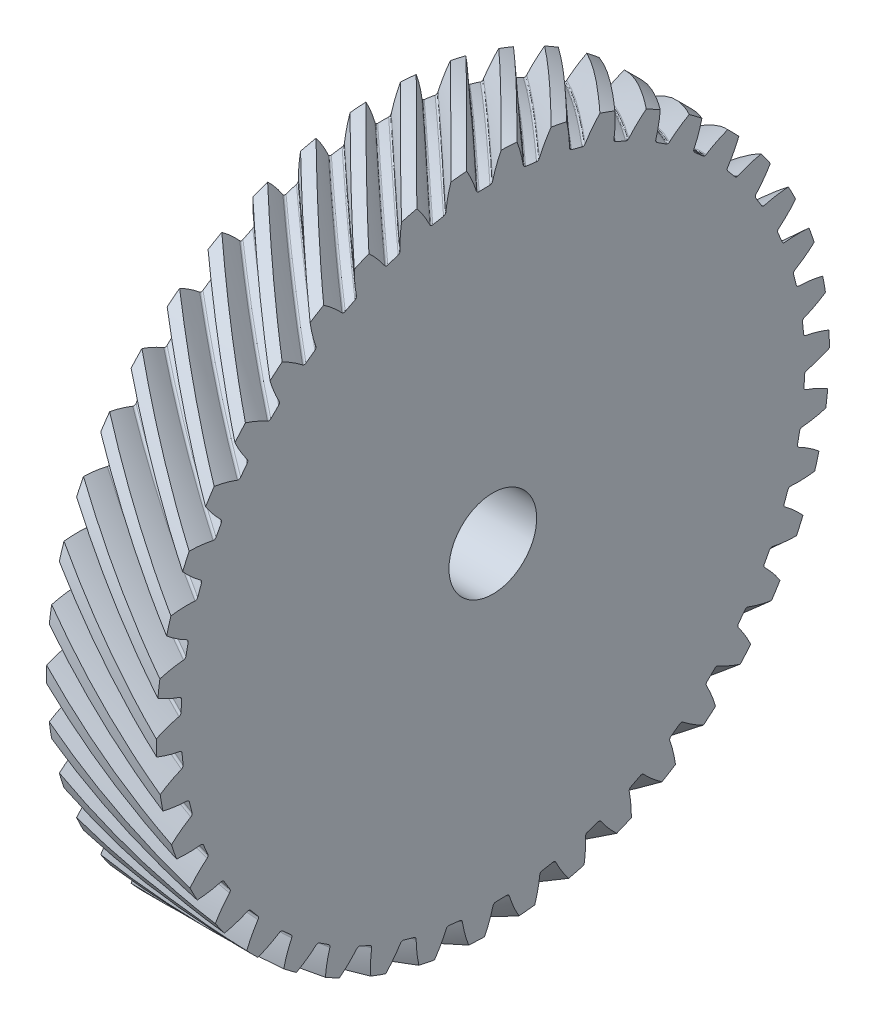
from build123d import *

# Parameters (mm, degrees)
BASPROSKE_W            = 25
BASPROSKE_H            = 76.746212025
TOOTHCUTRH_PITCH       = 482.210671775
TOOTHCUTRH_HEIGHT      = 25
TOOTHCUTRH_RADIUS      = 76.746212025
TOOTHCUTRH_START_ANGLE = -90
TEETHCUTSRH_COUNT      = 42
TEETHCUTSRH_ANGLE      = 351.428571429
BORSKE_R               = 10
BORE_DEPTH             = 62.5000025


with BuildPart() as part:
    # BasProSke → Base-Revolve (revolve)
    with BuildSketch(Plane(origin=(0, 0, 0), x_dir=(1, 0, 0), z_dir=(0, 1, 0)), mode=Mode.PRIVATE) as base_revolve_sk:
        with Locations((12.5, 38.373106013)):
            Rectangle(BASPROSKE_W, BASPROSKE_H)
    revolve(base_revolve_sk.sketch.rotate(Axis((-10, 0, 0), (1, 0, 0)), 180), axis=Axis((-10, 0, 0), (1, 0, 0)))

    # ToothCutRH: sweep along a helix
    with BuildLine() as toothcutrh_path:
        add(Helix(TOOTHCUTRH_PITCH, TOOTHCUTRH_HEIGHT, TOOTHCUTRH_RADIUS, center=(0, 0, 0), direction=(1, 0, 0), mode=Mode.PRIVATE).rotate(Axis((0, 0, 0), (1, 0, 0)), TOOTHCUTRH_START_ANGLE))
    # TooCutSkeRH → ToothCutRH (sweep, cut)
    with BuildSketch(Plane(origin=(0, 0, 0), x_dir=(0, 0, -1), z_dir=(1, 0, 0))):
        with BuildLine():
            ThreePointArc((1.246728238, 71.110283845), (0, 71.121212025), (-1.246728238, 71.110283845))
            ThreePointArc((-1.246728238, 71.110283845), (-1.629365037, 71.232459133), (-1.858985826, 71.562022502))
            ThreePointArc((-1.858985826, 71.562022502), (-3.28043798, 75.349162154), (-5.266874588, 78.87294174))
            ThreePointArc((-5.266874588, 78.87294174), (0, 79.048598385), (5.266874588, 78.87294174))
            ThreePointArc((5.266874588, 78.87294174), (3.28043798, 75.349162154), (1.858985826, 71.562022502))
            ThreePointArc((1.858985826, 71.562022502), (1.629365037, 71.232459133), (1.246728238, 71.110283845))
        make_face()
    toothcutrh = sweep(path=toothcutrh_path.line, is_frenet=True, mode=Mode.SUBTRACT)

    # TeethCutsRH: ToothCutRH ×42 about axis
    teethcutsrh_axis = Axis((-10, 0, 0), (1, 0, 0))
    for i in range(1, TEETHCUTSRH_COUNT):
        add(toothcutrh.rotate(teethcutsrh_axis, i * TEETHCUTSRH_ANGLE / (TEETHCUTSRH_COUNT - 1)), mode=Mode.SUBTRACT)

    # BorSke → Bore (cut, symmetric)
    with BuildSketch(Plane(origin=(0, 0, 0), x_dir=(0, 0, -1), z_dir=(1, 0, 0))):
        with Locations(Location((0, 0, 0), (0, 0, 180))):
            Circle(BORSKE_R)
    extrude(amount=BORE_DEPTH, both=True, mode=Mode.SUBTRACT)


solid = part.part
